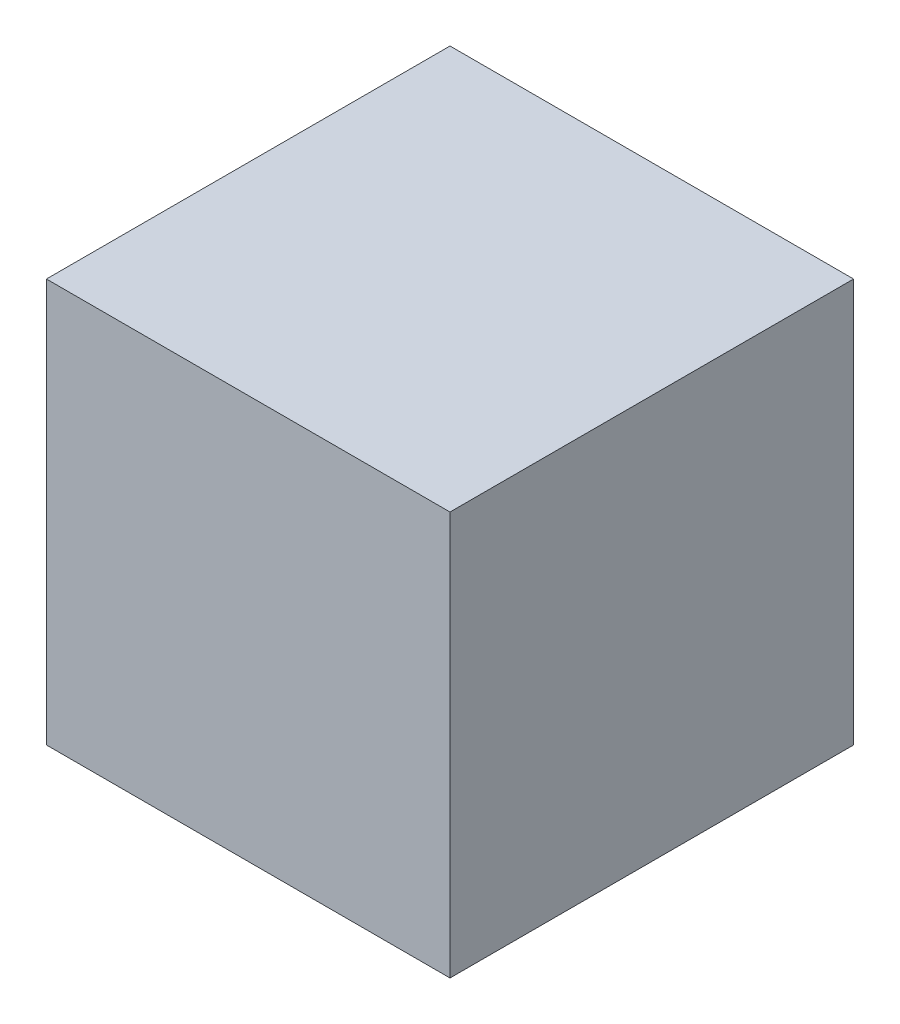
from build123d import *

# Parameters (mm, degrees)
BOSS_EXTRUDE1_DEPTH      = 4.7
BOSS_EXTRUDE1_DEPTH_BACK = 4.7
SKETCH1_W                = 9.4
SKETCH1_H                = 9.4


with BuildPart() as part:
    # Sketch1 → Boss-Extrude1 (new, two sides: drawn at the far end of the back side and taken through both)
    with BuildSketch(Plane(origin=(0, 0, 0), x_dir=(1, 0, 0), z_dir=(0, 1, 0)).offset(-BOSS_EXTRUDE1_DEPTH_BACK)):
        Rectangle(SKETCH1_W, SKETCH1_H)
    extrude(amount=BOSS_EXTRUDE1_DEPTH + BOSS_EXTRUDE1_DEPTH_BACK)


solid = part.part
